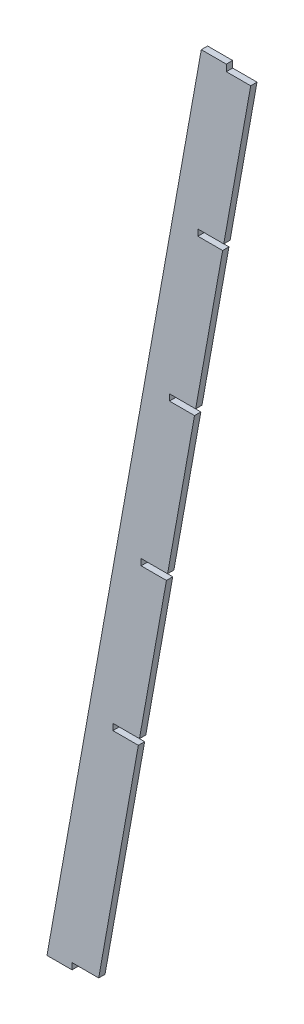
from build123d import *

# Parameters (mm, degrees)
CUT_EXTRUDE1_DEPTH = 5.08


with BuildPart() as part:
    # Sketch1 → Loft1 section 0
    with BuildSketch(Plane(origin=(0, 0, 0), x_dir=(1, 0, 0), z_dir=(0, 1, 0))):
        with BuildLine():
            Line((0, 0), (25.4, 0))
            Line((25.4, 0), (25.4, 3.175))
            Line((25.4, 3.175), (0, 3.175))
            Line((0, 3.175), (0, 0))
        make_face()
    # Sketch2 → Loft1 section 1
    with BuildSketch(Plane(origin=(0, 432.562, 0), x_dir=(1, 0, 0), z_dir=(0, 1, 0))):
        with BuildLine():
            Line((77.47, 0), (102.87, 0))
            Line((102.87, 0), (102.87, 3.175))
            Line((102.87, 3.175), (77.47, 3.175))
            Line((77.47, 3.175), (77.47, 0))
        make_face()
    loft()

    # Sketch3 → Cut-Extrude1 (cut)
    with BuildSketch(Plane.XY):
        Polygon((90.028717652, 432.562), (90.028717652, 429.26), (102.278625954, 429.26), (102.87, 432.562), align=None)
        Polygon((12.572909357, 3.175), (12.572909357, 0), (25.4, 0), (25.96862889, 3.175), align=None)
        Polygon((33.071424259, 117.475), (33.071424259, 114.3), (45.870640047, 114.3), (46.439268937, 117.475), align=None)
        Polygon((75.759721917, 353.738084411), (75.759721917, 350.595188566), (88.190095427, 350.595188566), (88.752974601, 353.738084411), align=None)
        Polygon((61.470871422, 274.955), (61.470871422, 271.78), (74.074633001, 271.78), (74.643261891, 274.955), align=None)
        Polygon((47.260398049, 193.04), (47.260398049, 196.215), (60.541265414, 196.215), (59.972636524, 193.04), align=None)
    extrude(amount=-CUT_EXTRUDE1_DEPTH, mode=Mode.SUBTRACT)


solid = part.part
